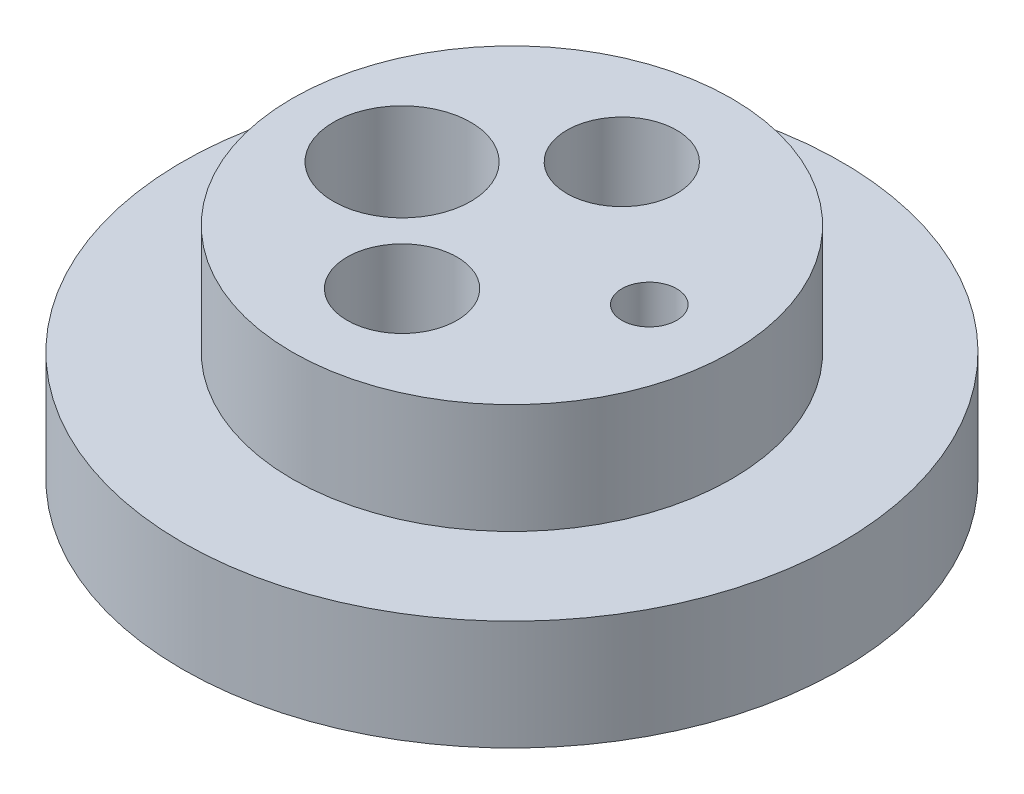
from build123d import *

# Parameters (mm, degrees)
SKETCH_1_R          = 24
EXTRUDE_1_DEPTH     = 8
SKETCH_2_R          = 16
EXTRUDE_2_DEPTH     = 8
SKETCH_4_R          = 5
SKETCH_4_R_2        = 4
SKETCH_4_R_3        = 2
CUT_EXTRUDE_1_DEPTH = 38.523326079


with BuildPart() as part:
    # 草图1 → 凸台-拉伸1 (new body)
    with BuildSketch(Plane(origin=(0, 0, 0), x_dir=(1, 0, 0), z_dir=(0, 1, 0))):
        Circle(SKETCH_1_R)
    extrude(amount=EXTRUDE_1_DEPTH)

    # 草图2 → 凸台-拉伸2 (add)
    with BuildSketch(Plane(origin=(0, 8, 0), x_dir=(1, 0, 0), z_dir=(0, 1, 0))):
        Circle(SKETCH_2_R)
    extrude(amount=EXTRUDE_2_DEPTH)

    # 草图4 → 切除-拉伸1 (cut, through all)
    with BuildSketch(Plane(origin=(0, 16, 0), x_dir=(1, 0, 0), z_dir=(0, 1, 0))):
        with Locations((-8, 0)):
            Circle(SKETCH_4_R)
        with Locations((0, 8)):
            Circle(SKETCH_4_R_2)
        with Locations((0, -8)):
            Circle(SKETCH_4_R_2)
        with Locations((10, 0)):
            Circle(SKETCH_4_R_3)
    extrude(amount=-CUT_EXTRUDE_1_DEPTH, mode=Mode.SUBTRACT)


solid = part.part
